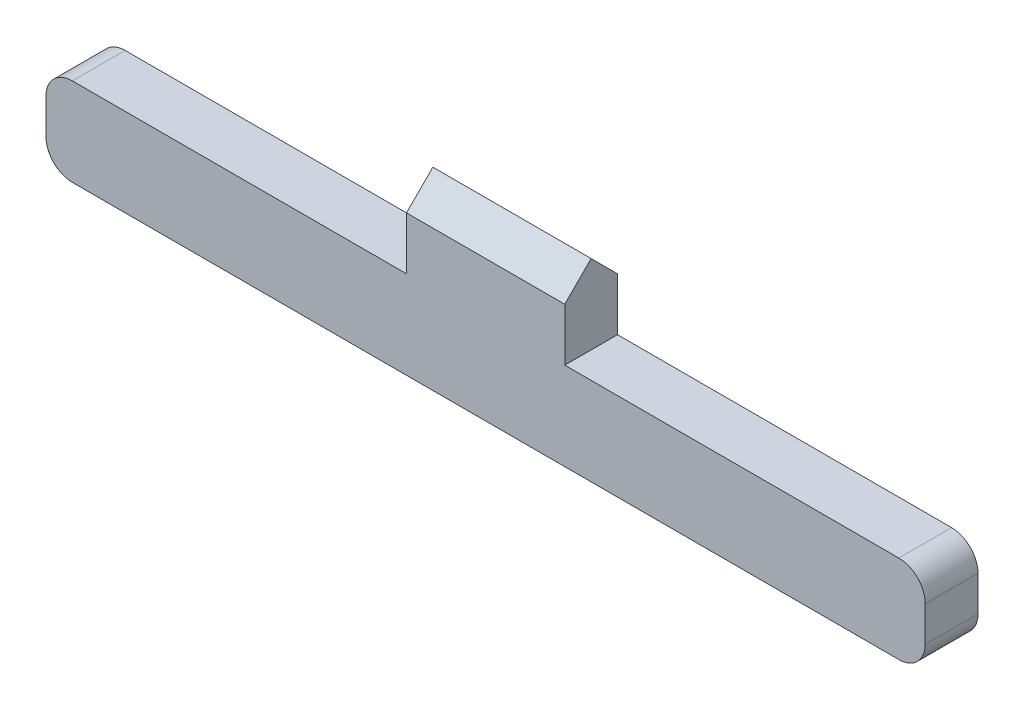
from build123d import *

# Parameters (mm, degrees)
EXTRUDE_1_DEPTH = 6
FILLET_1_R      = 3
CHAMFER_1_SIZE  = 3


with BuildPart() as part:
    # 草图1 → 凸台-拉伸1 (new body)
    with BuildSketch(Plane.XY):
        Polygon((-50, 0), (50, 0), (50, 10), (9, 10), (9, 19), (-9, 19), (-9, 10), (-50, 10), align=None)
    extrude(amount=EXTRUDE_1_DEPTH)

    # 圆角1
    fillet_1_edges = [part.edges().sort_by_distance(p)[0] for p in [
        (50, 10, 3),
        (50, 0, 3),
        (-50, 0, 3),
        (-50, 10, 3),
    ]]
    fillet(fillet_1_edges, radius=FILLET_1_R)

    # 倒角1
    chamfer_1_edges = [part.edges().sort_by_distance(p)[0] for p in [
        (0, 19, 6),
        (0, 19, 0),
    ]]
    chamfer(chamfer_1_edges, length=CHAMFER_1_SIZE - 0.0001)  # a hair under: the kernel refuses the full size


solid = part.part
